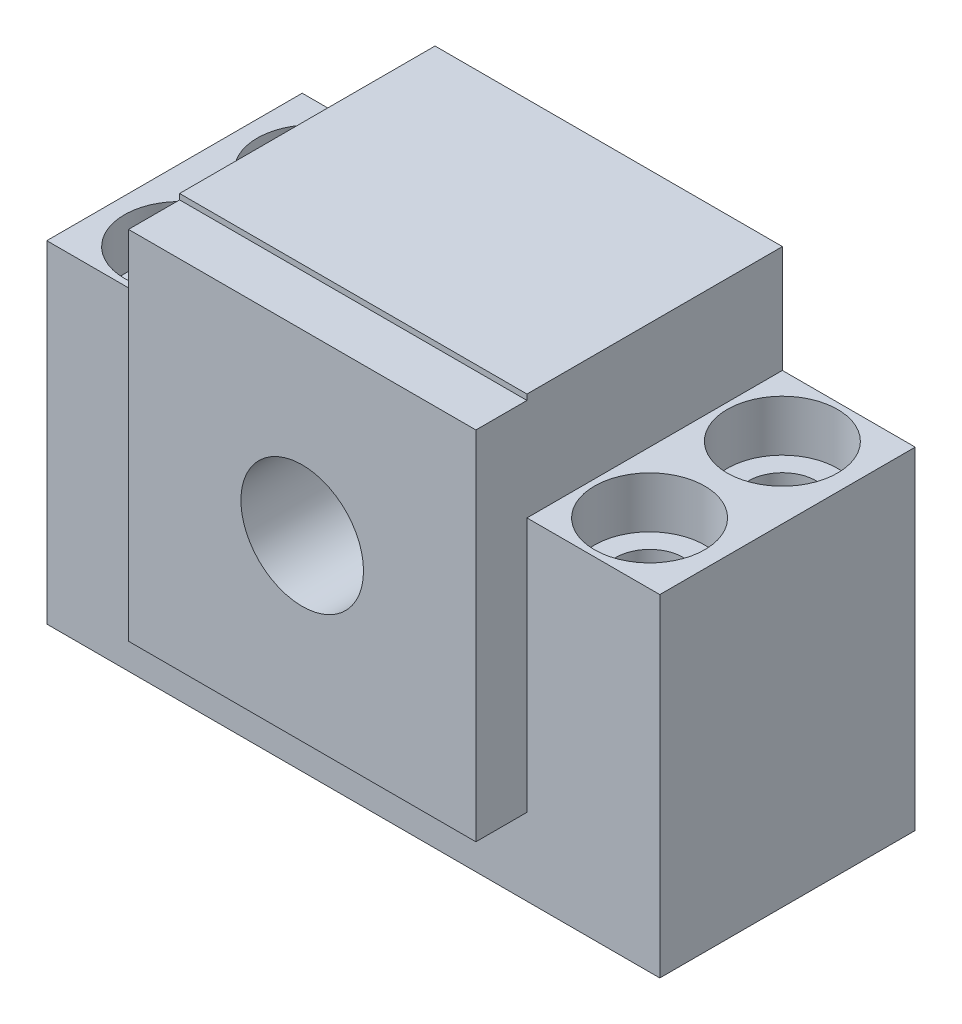
from build123d import *

# Parameters (mm, degrees)
ESQUISSE1_R             = 6
BOSS_EXTRU_1_DEPTH      = 25
ENL_V_MAT_EXTRU_1_REACH = 54.097
ESQUISSE2_R             = 3.3
ESQUISSE3_R             = 5.4
ENL_V_MAT_EXTRU_2_DEPTH = 5
ESQUISSE4_W             = 34
ESQUISSE4_H             = 34.910709465
ESQUISSE4_R             = 6
BOSS_EXTRU_2_DEPTH      = 5


with BuildPart() as part:
    # Esquisse1 → Boss.-Extru.1 (new body)
    with BuildSketch(Plane.XY):
        Polygon((-27.861974124, -13.935926773), (32.138025876, -13.935926773), (32.138025876, 18.564073227), (19.138025876, 18.564073227), (19.138025876, 29.064073227), (-14.861974124, 29.064073227), (-14.861974124, 18.564073227), (-27.861974124, 18.564073227), align=None)
        with Locations((2.138025876, 11.064073227)):
            Circle(ESQUISSE1_R, mode=Mode.SUBTRACT)
    extrude(amount=BOSS_EXTRU_1_DEPTH)

    # Esquisse2 → Enlèv. mat.-Extru.1 (cut, up to next)
    with BuildSketch(Plane(origin=(0, 18.564073227, 0), x_dir=(1, 0, 0), z_dir=(0, 1, 0)), mode=Mode.PRIVATE) as enl_v_mat_extru_1_sk1:
        with Locations((25.138025876, -19)):
            Circle(ESQUISSE2_R)
    enl_v_mat_extru_1_tool1 = extrude(enl_v_mat_extru_1_sk1.sketch, amount=-ENL_V_MAT_EXTRU_1_REACH, mode=Mode.PRIVATE) & part.part
    # Esquisse2 → Enlèv. mat.-Extru.1 (cut, up to next)
    with BuildSketch(Plane(origin=(0, 18.564073227, 0), x_dir=(1, 0, 0), z_dir=(0, 1, 0)), mode=Mode.PRIVATE) as enl_v_mat_extru_1_sk2:
        with Locations((25.138025876, -6)):
            Circle(ESQUISSE2_R)
    enl_v_mat_extru_1_tool2 = extrude(enl_v_mat_extru_1_sk2.sketch, amount=-ENL_V_MAT_EXTRU_1_REACH, mode=Mode.PRIVATE) & part.part
    # Esquisse2 → Enlèv. mat.-Extru.1 (cut, up to next)
    with BuildSketch(Plane(origin=(0, 18.564073227, 0), x_dir=(1, 0, 0), z_dir=(0, 1, 0)), mode=Mode.PRIVATE) as enl_v_mat_extru_1_sk3:
        with Locations((-20.861974124, -19)):
            Circle(ESQUISSE2_R)
    enl_v_mat_extru_1_tool3 = extrude(enl_v_mat_extru_1_sk3.sketch, amount=-ENL_V_MAT_EXTRU_1_REACH, mode=Mode.PRIVATE) & part.part
    # Esquisse2 → Enlèv. mat.-Extru.1 (cut, up to next)
    with BuildSketch(Plane(origin=(0, 18.564073227, 0), x_dir=(1, 0, 0), z_dir=(0, 1, 0)), mode=Mode.PRIVATE) as enl_v_mat_extru_1_sk4:
        with Locations((-20.861974124, -6)):
            Circle(ESQUISSE2_R)
    enl_v_mat_extru_1_tool4 = extrude(enl_v_mat_extru_1_sk4.sketch, amount=-ENL_V_MAT_EXTRU_1_REACH, mode=Mode.PRIVATE) & part.part
    add(enl_v_mat_extru_1_tool1.solids().sort_by_distance((25.138026, 18.564073, 19))[0], mode=Mode.SUBTRACT)
    add(enl_v_mat_extru_1_tool2.solids().sort_by_distance((25.138026, 18.564073, 6))[0], mode=Mode.SUBTRACT)
    add(enl_v_mat_extru_1_tool3.solids().sort_by_distance((-20.861974, 18.564073, 19))[0], mode=Mode.SUBTRACT)
    add(enl_v_mat_extru_1_tool4.solids().sort_by_distance((-20.861974, 18.564073, 6))[0], mode=Mode.SUBTRACT)

    # Esquisse3 → Enlèv. mat.-Extru.2 (cut)
    with BuildSketch(Plane(origin=(0, 18.564073227, 0), x_dir=(1, 0, 0), z_dir=(0, 1, 0))):
        with Locations((25.138025876, -19)):
            Circle(ESQUISSE3_R)
        with Locations((25.138025876, -6)):
            Circle(ESQUISSE3_R)
        with Locations((-20.861974124, -6)):
            Circle(ESQUISSE3_R)
        with Locations((-20.861974124, -19)):
            Circle(ESQUISSE3_R)
    extrude(amount=-ENL_V_MAT_EXTRU_2_DEPTH, mode=Mode.SUBTRACT)

    # Esquisse4 → Boss.-Extru.2 (add)
    with BuildSketch(Plane.XY.offset(25)):
        with Locations((2.138025876, 11.064073226)):
            Rectangle(ESQUISSE4_W, ESQUISSE4_H)
        with Locations((2.138025876, 11.064073227)):
            Circle(ESQUISSE4_R, mode=Mode.SUBTRACT)
    extrude(amount=BOSS_EXTRU_2_DEPTH)


solid = part.part
